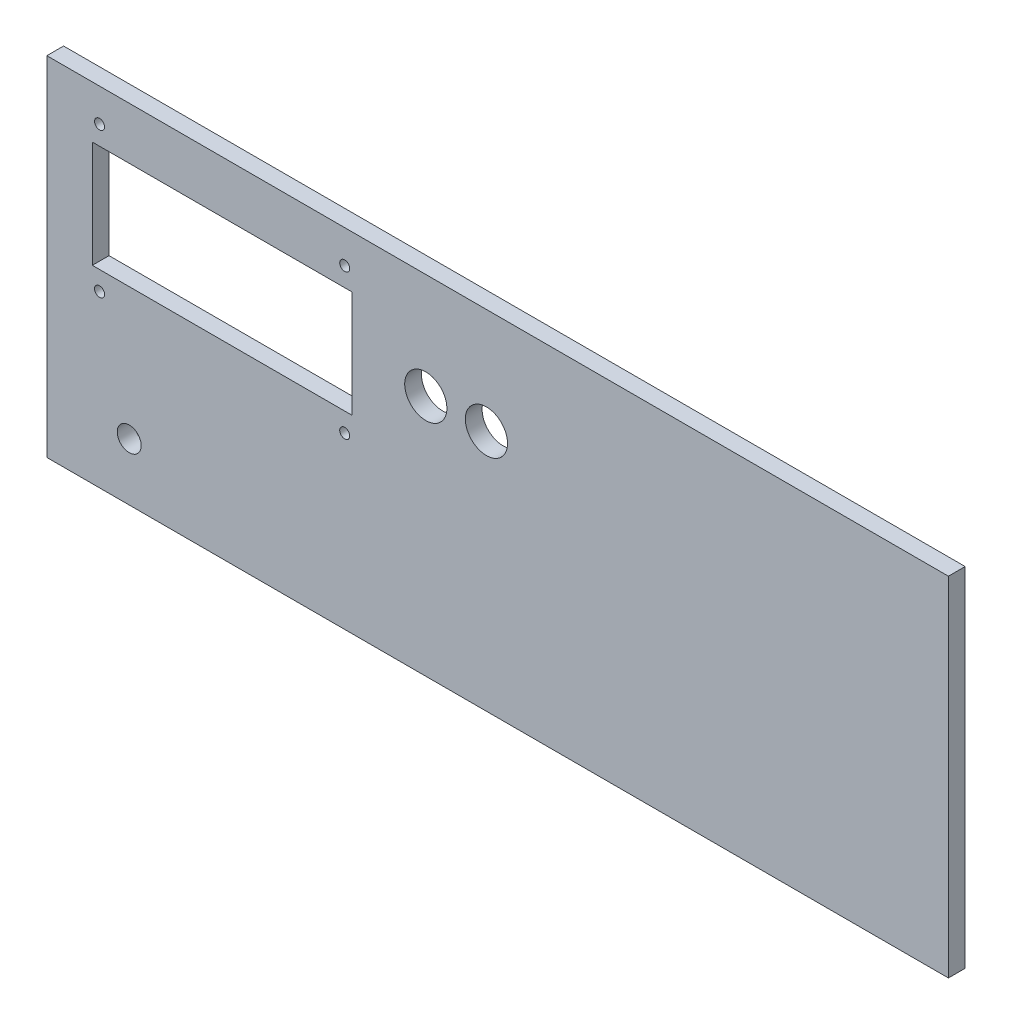
from build123d import *

# Parameters (mm, degrees)
SKETCH1_W           = 342
SKETCH1_H           = 132
SKETCH1_R           = 1.9
SKETCH1_R_2         = 8
SKETCH1_R_3         = 4.55
SKETCH1_W_2         = 98.5
SKETCH1_H_2         = 40.5
BOSS_EXTRUDE1_DEPTH = 6.35


with BuildPart() as part:
    # Sketch1 → Boss-Extrude1 (new body)
    with BuildSketch(Plane.XY):
        with Locations((171, 66)):
            Rectangle(SKETCH1_W, SKETCH1_H)
        with Locations((112.999995121, 119.499997115)):
            Circle(SKETCH1_R, mode=Mode.SUBTRACT)
        with Locations((113.000004879, 64.499997115)):
            Circle(SKETCH1_R, mode=Mode.SUBTRACT)
        with Locations((20.000004879, 64.500002885)):
            Circle(SKETCH1_R, mode=Mode.SUBTRACT)
        with Locations((19.999995121, 119.500002885)):
            Circle(SKETCH1_R, mode=Mode.SUBTRACT)
        with Locations((143.75, 92)):
            Circle(SKETCH1_R_2, mode=Mode.SUBTRACT)
        with Locations((166.75, 92)):
            Circle(SKETCH1_R_2, mode=Mode.SUBTRACT)
        with Locations((31.25, 21.75)):
            Circle(SKETCH1_R_3, mode=Mode.SUBTRACT)
        with Locations((66.5, 92)):
            Rectangle(SKETCH1_W_2, SKETCH1_H_2, mode=Mode.SUBTRACT)
    extrude(amount=BOSS_EXTRUDE1_DEPTH)


solid = part.part
